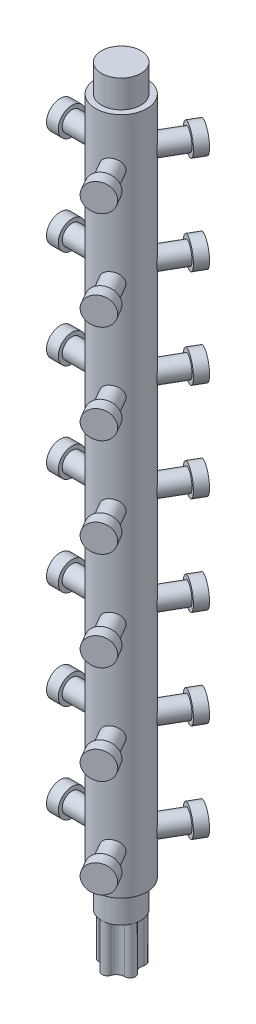
from build123d import *

# Parameters (mm, degrees)
SKETCH1_R               = 3.25
SKETCH1_R_2             = 2.5
BOSS_EXTRUDE1_DEPTH     = 93.25
SKETCH1_3_R             = 3.25
SKETCH1_3_R_2           = 2.5
CUT_EXTRUDE1_DEPTH      = 3.5
CUT_EXTRUDE2_START      = 89.75
SKETCH1_4_R             = 3.25
SKETCH1_4_R_2           = 2.5
CUT_EXTRUDE2_DEPTH      = 3.5
BOSS_EXTRUDE3_START     = -0.250000103
BOSS_EXTRUDE3_OUTLINE_R = 1.25
BOSS_EXTRUDE3_DEPTH     = 3.250000103
BOSS_EXTRUDE3_START_2   = 6
BOSS_EXTRUDE3_2_DEPTH   = 5
BOSS_EXTRUDE4_START     = 3
SKETCH2_3_R             = 1.75
SKETCH2_3_R_2           = 1.25
BOSS_EXTRUDE4_DEPTH     = 1.5
LPATTERN2_COUNT         = 7
LPATTERN2_PITCH         = 12.5
CIRPATTERN6_COUNT       = 3
SKETCH4_R               = 0.675
BOSS_EXTRUDE6_DEPTH     = 6


with BuildPart() as part:
    # Sketch1 → Boss-Extrude1 (new body)
    # profile 1 of 2: a face of its own
    with BuildSketch(Plane(origin=(0, 0, 0), x_dir=(1, 0, 0), z_dir=(0, 1, 0))):
        with Locations(Location((0, 0, 0), (0, 0, 270))):
            Circle(SKETCH1_R)
        Circle(SKETCH1_R_2, mode=Mode.SUBTRACT)
    # profile 2 of 2: a face of its own
    with BuildSketch(Plane(origin=(0, 0, 0), x_dir=(1, 0, 0), z_dir=(0, 1, 0))):
        Circle(SKETCH1_R_2)
    extrude(amount=BOSS_EXTRUDE1_DEPTH)

    # Sketch1<3> → Cut-Extrude1 (cut)
    with BuildSketch(Plane(origin=(0, 0, 0), x_dir=(1, 0, 0), z_dir=(0, 1, 0))):
        with Locations(Location((0, 0, 0), (0, 0, 270))):
            Circle(SKETCH1_3_R)
        with Locations(Location((0, 0, 0), (0, 0, 270))):
            Circle(SKETCH1_3_R_2, mode=Mode.SUBTRACT)
    extrude(amount=CUT_EXTRUDE1_DEPTH, mode=Mode.SUBTRACT)

    # Sketch1<4> → Cut-Extrude2 (cut)
    with BuildSketch(Plane(origin=(0, 0, 0), x_dir=(1, 0, 0), z_dir=(0, 1, 0)).offset(CUT_EXTRUDE2_START)):
        with Locations(Location((0, 0, 0), (0, 0, 270))):
            Circle(SKETCH1_4_R)
        with Locations(Location((0, 0, 0), (0, 0, 270))):
            Circle(SKETCH1_4_R_2, mode=Mode.SUBTRACT)
    extrude(amount=CUT_EXTRUDE2_DEPTH, mode=Mode.SUBTRACT)


with BuildPart() as body_2:
    # Boss-Extrude3: read off the stored shape, not the designer's step
    # Boss-Extrude3 outline → Boss-Extrude3 (new body)
    with BuildSketch(Plane.ZY.offset(3.25).offset(BOSS_EXTRUDE3_START)):
        with Locations((0, 8.625)):
            Circle(BOSS_EXTRUDE3_OUTLINE_R)
    extrude(amount=BOSS_EXTRUDE3_DEPTH)

    # Boss-Extrude3 2 outline → Boss-Extrude3 2 (cut)
    with BuildSketch(Plane(origin=(0, 0, 0), x_dir=(1, 0, 0), z_dir=(0, 1, 0)).offset(BOSS_EXTRUDE3_START_2)):
        with BuildLine():
            ThreePointArc((-2.999999985, 1.250000036), (-3.25, -5.06e-07), (-2.999999596, -1.250000971))
            Line((-2.999999596, -1.250000971), (-2.999999985, 1.250000036))
        make_face()
    extrude(amount=BOSS_EXTRUDE3_2_DEPTH, mode=Mode.SUBTRACT)


with BuildPart() as body_3:
    # Sketch2<3> → Boss-Extrude4 (new body)
    # profile 1 of 2: a face of its own
    with BuildSketch(Plane.ZY.offset(3.25).offset(BOSS_EXTRUDE4_START)):
        with Locations((0, 8.625)):
            Circle(SKETCH2_3_R)
        with Locations((0, 8.625)):
            Circle(SKETCH2_3_R_2, mode=Mode.SUBTRACT)
    # profile 2 of 2: a face of its own
    with BuildSketch(Plane.ZY.offset(3.25).offset(BOSS_EXTRUDE4_START)):
        with Locations((0, 8.625)):
            Circle(SKETCH2_3_R_2)
    extrude(amount=BOSS_EXTRUDE4_DEPTH)


with BuildPart() as lpattern2_1:
    # LPattern2: pattern copy
    add(body_2.part.moved(Location(Vector(0, 1, 0) * (1 * LPATTERN2_PITCH))))


with BuildPart() as lpattern2_2:
    # LPattern2: pattern copy
    add(body_2.part.moved(Location(Vector(0, 1, 0) * (2 * LPATTERN2_PITCH))))


with BuildPart() as lpattern2_3:
    # LPattern2: pattern copy
    add(body_2.part.moved(Location(Vector(0, 1, 0) * (3 * LPATTERN2_PITCH))))


with BuildPart() as lpattern2_4:
    # LPattern2: pattern copy
    add(body_2.part.moved(Location(Vector(0, 1, 0) * (4 * LPATTERN2_PITCH))))


with BuildPart() as lpattern2_5:
    # LPattern2: pattern copy
    add(body_2.part.moved(Location(Vector(0, 1, 0) * (5 * LPATTERN2_PITCH))))


with BuildPart() as lpattern2_6:
    # LPattern2: pattern copy
    add(body_2.part.moved(Location(Vector(0, 1, 0) * (6 * LPATTERN2_PITCH))))


with BuildPart() as lpattern2_7:
    # LPattern2: pattern copy
    add(body_3.part.moved(Location(Vector(0, 1, 0) * (1 * LPATTERN2_PITCH))))


with BuildPart() as lpattern2_8:
    # LPattern2: pattern copy
    add(body_3.part.moved(Location(Vector(0, 1, 0) * (2 * LPATTERN2_PITCH))))


with BuildPart() as lpattern2_9:
    # LPattern2: pattern copy
    add(body_3.part.moved(Location(Vector(0, 1, 0) * (3 * LPATTERN2_PITCH))))


with BuildPart() as lpattern2_10:
    # LPattern2: pattern copy
    add(body_3.part.moved(Location(Vector(0, 1, 0) * (4 * LPATTERN2_PITCH))))


with BuildPart() as lpattern2_11:
    # LPattern2: pattern copy
    add(body_3.part.moved(Location(Vector(0, 1, 0) * (5 * LPATTERN2_PITCH))))


with BuildPart() as lpattern2_12:
    # LPattern2: pattern copy
    add(body_3.part.moved(Location(Vector(0, 1, 0) * (6 * LPATTERN2_PITCH))))


with BuildPart() as cirpattern6_1:
    # CirPattern6: pattern copy
    add(lpattern2_12.part.rotate(Axis((0, 0, 0), (0, 1, 0)), 1 * 360 / CIRPATTERN6_COUNT))


with BuildPart() as cirpattern6_2:
    # CirPattern6: pattern copy
    add(lpattern2_12.part.rotate(Axis((0, 0, 0), (0, 1, 0)), 2 * 360 / CIRPATTERN6_COUNT))


with BuildPart() as cirpattern6_3:
    # CirPattern6: pattern copy
    add(lpattern2_6.part.rotate(Axis((0, 0, 0), (0, 1, 0)), 1 * 360 / CIRPATTERN6_COUNT))


with BuildPart() as cirpattern6_4:
    # CirPattern6: pattern copy
    add(lpattern2_6.part.rotate(Axis((0, 0, 0), (0, 1, 0)), 2 * 360 / CIRPATTERN6_COUNT))


with BuildPart() as cirpattern6_5:
    # CirPattern6: pattern copy
    add(lpattern2_11.part.rotate(Axis((0, 0, 0), (0, 1, 0)), 1 * 360 / CIRPATTERN6_COUNT))


with BuildPart() as cirpattern6_6:
    # CirPattern6: pattern copy
    add(lpattern2_11.part.rotate(Axis((0, 0, 0), (0, 1, 0)), 2 * 360 / CIRPATTERN6_COUNT))


with BuildPart() as cirpattern6_7:
    # CirPattern6: pattern copy
    add(lpattern2_5.part.rotate(Axis((0, 0, 0), (0, 1, 0)), 1 * 360 / CIRPATTERN6_COUNT))


with BuildPart() as cirpattern6_8:
    # CirPattern6: pattern copy
    add(lpattern2_5.part.rotate(Axis((0, 0, 0), (0, 1, 0)), 2 * 360 / CIRPATTERN6_COUNT))


with BuildPart() as cirpattern6_9:
    # CirPattern6: pattern copy
    add(body_3.part.rotate(Axis((0, 0, 0), (0, 1, 0)), 1 * 360 / CIRPATTERN6_COUNT))


with BuildPart() as cirpattern6_10:
    # CirPattern6: pattern copy
    add(body_3.part.rotate(Axis((0, 0, 0), (0, 1, 0)), 2 * 360 / CIRPATTERN6_COUNT))


with BuildPart() as cirpattern6_11:
    # CirPattern6: pattern copy
    add(body_2.part.rotate(Axis((0, 0, 0), (0, 1, 0)), 1 * 360 / CIRPATTERN6_COUNT))


with BuildPart() as cirpattern6_12:
    # CirPattern6: pattern copy
    add(body_2.part.rotate(Axis((0, 0, 0), (0, 1, 0)), 2 * 360 / CIRPATTERN6_COUNT))


with BuildPart() as cirpattern6_13:
    # CirPattern6: pattern copy
    add(lpattern2_7.part.rotate(Axis((0, 0, 0), (0, 1, 0)), 1 * 360 / CIRPATTERN6_COUNT))


with BuildPart() as cirpattern6_14:
    # CirPattern6: pattern copy
    add(lpattern2_7.part.rotate(Axis((0, 0, 0), (0, 1, 0)), 2 * 360 / CIRPATTERN6_COUNT))


with BuildPart() as cirpattern6_15:
    # CirPattern6: pattern copy
    add(lpattern2_1.part.rotate(Axis((0, 0, 0), (0, 1, 0)), 1 * 360 / CIRPATTERN6_COUNT))


with BuildPart() as cirpattern6_16:
    # CirPattern6: pattern copy
    add(lpattern2_1.part.rotate(Axis((0, 0, 0), (0, 1, 0)), 2 * 360 / CIRPATTERN6_COUNT))


with BuildPart() as cirpattern6_17:
    # CirPattern6: pattern copy
    add(lpattern2_8.part.rotate(Axis((0, 0, 0), (0, 1, 0)), 1 * 360 / CIRPATTERN6_COUNT))


with BuildPart() as cirpattern6_18:
    # CirPattern6: pattern copy
    add(lpattern2_8.part.rotate(Axis((0, 0, 0), (0, 1, 0)), 2 * 360 / CIRPATTERN6_COUNT))


with BuildPart() as cirpattern6_19:
    # CirPattern6: pattern copy
    add(lpattern2_2.part.rotate(Axis((0, 0, 0), (0, 1, 0)), 1 * 360 / CIRPATTERN6_COUNT))


with BuildPart() as cirpattern6_20:
    # CirPattern6: pattern copy
    add(lpattern2_2.part.rotate(Axis((0, 0, 0), (0, 1, 0)), 2 * 360 / CIRPATTERN6_COUNT))


with BuildPart() as cirpattern6_21:
    # CirPattern6: pattern copy
    add(lpattern2_9.part.rotate(Axis((0, 0, 0), (0, 1, 0)), 1 * 360 / CIRPATTERN6_COUNT))


with BuildPart() as cirpattern6_22:
    # CirPattern6: pattern copy
    add(lpattern2_9.part.rotate(Axis((0, 0, 0), (0, 1, 0)), 2 * 360 / CIRPATTERN6_COUNT))


with BuildPart() as cirpattern6_23:
    # CirPattern6: pattern copy
    add(lpattern2_3.part.rotate(Axis((0, 0, 0), (0, 1, 0)), 1 * 360 / CIRPATTERN6_COUNT))


with BuildPart() as cirpattern6_24:
    # CirPattern6: pattern copy
    add(lpattern2_3.part.rotate(Axis((0, 0, 0), (0, 1, 0)), 2 * 360 / CIRPATTERN6_COUNT))


with BuildPart() as cirpattern6_25:
    # CirPattern6: pattern copy
    add(lpattern2_10.part.rotate(Axis((0, 0, 0), (0, 1, 0)), 1 * 360 / CIRPATTERN6_COUNT))


with BuildPart() as cirpattern6_26:
    # CirPattern6: pattern copy
    add(lpattern2_10.part.rotate(Axis((0, 0, 0), (0, 1, 0)), 2 * 360 / CIRPATTERN6_COUNT))


with BuildPart() as cirpattern6_27:
    # CirPattern6: pattern copy
    add(lpattern2_4.part.rotate(Axis((0, 0, 0), (0, 1, 0)), 1 * 360 / CIRPATTERN6_COUNT))


with BuildPart() as cirpattern6_28:
    # CirPattern6: pattern copy
    add(lpattern2_4.part.rotate(Axis((0, 0, 0), (0, 1, 0)), 2 * 360 / CIRPATTERN6_COUNT))


with BuildPart() as part_1:
    add(part.part)

    # Combine1: read off the stored shape, not the designer's step
    # Combine1: union LPattern2_4, CirPattern6_14, CirPattern6_9, LPattern2_7, CirPattern6_18, CirPattern6_22, CirPattern6_13, LPattern2_2, CirPattern6_26, CirPattern6_17, CirPattern6_12, LPattern2_8, CirPattern6_21, CirPattern6_16, CirPattern6_25, CirPattern6_20, body 3, CirPattern6_24, LPattern2_9, CirPattern6_28, LPattern2_3, LPattern2_10, CirPattern6_11, CirPattern6_15, CirPattern6_19, LPattern2_1, CirPattern6_23, body 2, CirPattern6_27, CirPattern6_10
    add(lpattern2_4.part)
    add(cirpattern6_14.part)
    add(cirpattern6_9.part)
    add(lpattern2_7.part)
    add(cirpattern6_18.part)
    add(cirpattern6_22.part)
    add(cirpattern6_13.part)
    add(lpattern2_2.part)
    add(cirpattern6_26.part)
    add(cirpattern6_17.part)
    add(cirpattern6_12.part)
    add(lpattern2_8.part)
    add(cirpattern6_21.part)
    add(cirpattern6_16.part)
    add(cirpattern6_25.part)
    add(cirpattern6_20.part)
    add(body_3.part)
    add(cirpattern6_24.part)
    add(lpattern2_9.part)
    add(cirpattern6_28.part)
    add(lpattern2_3.part)
    add(lpattern2_10.part)
    add(cirpattern6_11.part)
    add(cirpattern6_15.part)
    add(cirpattern6_19.part)
    add(lpattern2_1.part)
    add(cirpattern6_23.part)
    add(body_2.part)
    add(cirpattern6_27.part)
    add(cirpattern6_10.part)

    # Sketch4 → Boss-Extrude6 (add)
    with BuildSketch(Plane.XZ):
        with BuildLine():
            ThreePointArc((0.644322262, 1.95118107), (0.667286493, 1.851753313), (0.675, 1.75))
            ThreePointArc((0.675, 1.75), (-0.101753307, 1.082713506), (-0.644322265, 1.95118106))
            ThreePointArc((-0.644322265, 1.95118106), (-1.028624177, 1.415779751), (-1.656576895, 1.215734995))
            ThreePointArc((-1.656576895, 1.215734995), (-1.184311871, 1.015321042), (-0.989348904, 0.54077974))
            ThreePointArc((-0.989348904, 0.54077974), (-1.354447889, -0.058875462), (-2.054789973, -0.009838795))
            ThreePointArc((-2.054789973, -0.009838795), (-1.730024088, -0.383507831), (-1.613065355, -0.864571322))
            ThreePointArc((-1.613065355, -0.864571322), (-1.626926475, -1.034440548), (-1.668143109, -1.199815496))
            ThreePointArc((-1.668143109, -1.199815496), (-0.919194463, -0.749709072), (-0.353624192, -1.41577974))
            ThreePointArc((-0.353624192, -1.41577974), (-0.425440526, -1.718755756), (-0.625607795, -1.957261766))
            ThreePointArc((-0.625607795, -1.957261766), (0, -1.75), (0.625607795, -1.957261766))
            ThreePointArc((0.625607795, -1.957261766), (0.631869137, -0.869693276), (1.668143109, -1.199815496))
            ThreePointArc((1.668143109, -1.199815496), (1.664348915, -0.540779704), (2.054790039, -0.009838748))
            ThreePointArc((2.054790039, -0.009838748), (1.022385769, 0.332193226), (1.6565769, 1.215734995))
            ThreePointArc((1.6565769, 1.215734995), (1.028624174, 1.415779753), (0.644322262, 1.95118107))
        make_face()
        with Locations((0, 1.75)):
            Circle(SKETCH4_R)
        with Locations((-1.664348904, 0.54077974)):
            Circle(SKETCH4_R)
        with Locations((-1.028624192, -1.41577974)):
            Circle(SKETCH4_R)
        with Locations((1.028624192, -1.41577974)):
            Circle(SKETCH4_R)
        with Locations((1.664348904, 0.54077974)):
            Circle(SKETCH4_R)
    extrude(amount=BOSS_EXTRUDE6_DEPTH)


solid = Compound([lpattern2_5.part, lpattern2_6.part, lpattern2_11.part, lpattern2_12.part, cirpattern6_1.part, cirpattern6_2.part, cirpattern6_3.part, cirpattern6_4.part, cirpattern6_5.part, cirpattern6_6.part, cirpattern6_7.part, cirpattern6_8.part, part_1.part])
